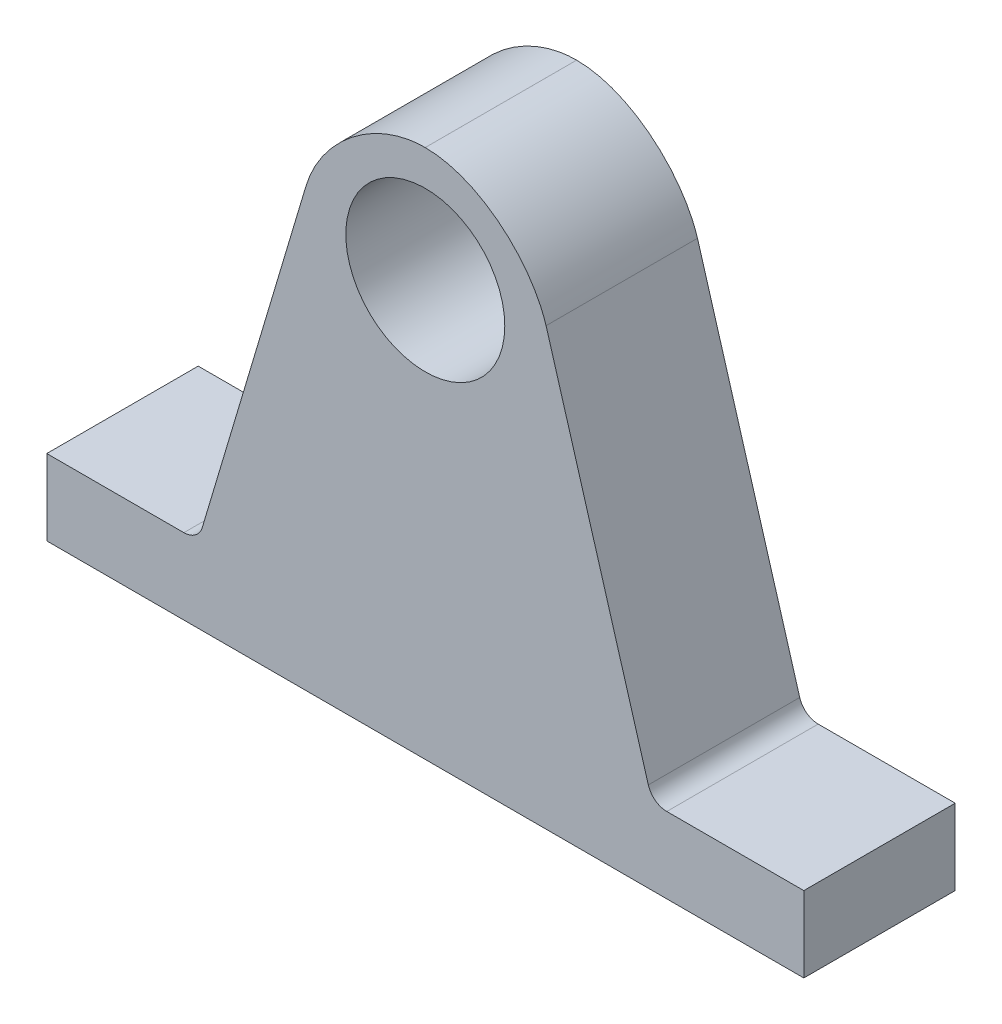
from build123d import *

# Parameters (mm, degrees)
SKETCH1_W           = 100
SKETCH1_H           = 20
BOSS_EXTRUDE1_DEPTH = 10
SKETCH2_W           = 60
SKETCH2_H           = 20
BOSS_EXTRUDE2_DEPTH = 60
SKETCH3_R           = 10.5
CUT_EXTRUDE1_DEPTH  = 60
CUT_EXTRUDE2_START  = -20
CUT_EXTRUDE2_DEPTH  = 20
FILLET1_R           = 2.54
FILLET2_R           = 2.54


# Read off the part's stored shape, not the designer's step: Cut-Extrude2
with BuildPart() as part:
    # Sketch1 → Boss-Extrude1 (new body)
    with BuildSketch(Plane(origin=(0, 0, 0), x_dir=(1, 0, 0), z_dir=(0, 1, 0))):
        with Locations((0.812697448, -5.425302539)):
            Rectangle(SKETCH1_W, SKETCH1_H)
    extrude(amount=BOSS_EXTRUDE1_DEPTH)

    # Sketch2 → Boss-Extrude2 (add)
    with BuildSketch(Plane(origin=(0, 10, 0), x_dir=(1, 0, 0), z_dir=(0, 1, 0))):
        with Locations((0.812697448, -5.425302539)):
            Rectangle(SKETCH2_W, SKETCH2_H)
    extrude(amount=BOSS_EXTRUDE2_DEPTH)

    # Sketch3 → Cut-Extrude1 (cut)
    with BuildSketch(Plane.XY.offset(15.425302539)):
        with Locations((0.812697448, 54.837920596)):
            Circle(SKETCH3_R)
    extrude(amount=-CUT_EXTRUDE1_DEPTH, mode=Mode.SUBTRACT)

    # Cut-Extrude2 outline → Cut-Extrude2 (cut)
    with BuildSketch(Plane.XY.offset(15.425302539).offset(CUT_EXTRUDE2_START)):
        with BuildLine():
            Line((-29.187302552, 10), (-14.985674084, 57.602633157))
            add(Edge.make_bspline(
                [(-14.985674084, 57.602633157), (-13.129301822, 64.096984003), (-6.152391174, 70.000002699), (0.804550116, 70.000002699)],
                knots=[0, 0, 0, 0, 0.498740566, 0.498740566, 0.498740566, 0.498740566], degree=3))
            Line((0.804550116, 70.000002699), (-29.187302552, 70))
            Line((-29.187302552, 70), (-29.187302552, 10))
        make_face()
        with BuildLine():
            Line((30.812697448, 70), (0.80589599, 70.000002625))
            add(Edge.make_bspline(
                [(0.80589599, 70.000002625), (0.808163145, 70.000002377), (7.799782278, 69.997303833), (14.769205665, 64.030481045), (16.767488499, 57.602633157)],
                knots=[0.498772728, 0.498772728, 0.498772728, 0.498772728, 0.49893526, 1, 1, 1, 1], degree=3))
            Line((16.767488499, 57.602633157), (30.812697448, 10))
            Line((30.812697448, 10), (30.812697448, 70))
        make_face()
    extrude(amount=CUT_EXTRUDE2_DEPTH, mode=Mode.SUBTRACT)

    # Fillet1
    fillet1_edges = [part.edges().sort_by_distance(p)[0] for p in [
        (-29.187302552, 10, 5.425302539),
    ]]
    fillet(fillet1_edges, radius=FILLET1_R)

    # Fillet2
    fillet2_edges = [part.edges().sort_by_distance(p)[0] for p in [
        (30.812697448, 10, 5.425302539),
    ]]
    fillet(fillet2_edges, radius=FILLET2_R)


solid = part.part
